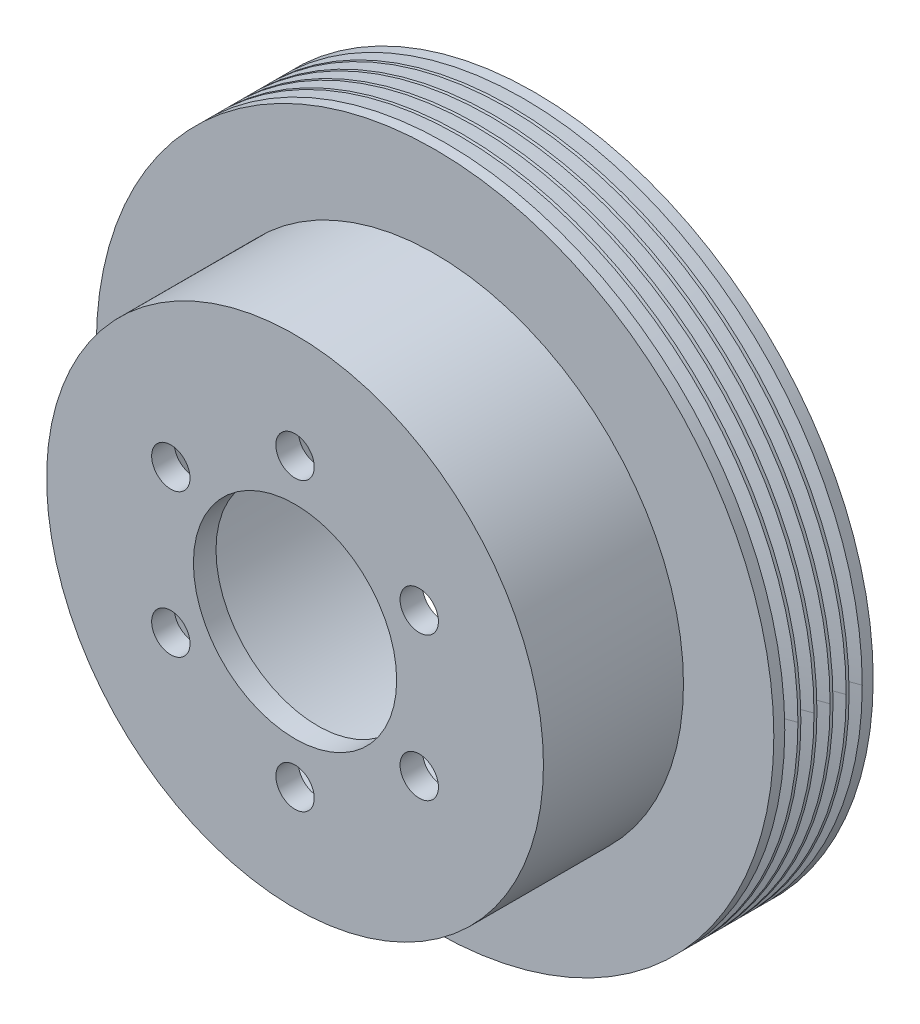
from build123d import *

# Parameters (mm, degrees)
ESQUISSE1_R                  = 75
BOSS_EXTRU_1_DEPTH           = 53
ENL_V_START                  = -31
ESQUISSE2_R                  = 75
ESQUISSE2_R_2                = 55
ENL_V_MAT_EXTRU_1_DEPTH      = 31
ESQUISSE3_R                  = 45
ENL_V_MAT_EXTRU_2_DEPTH      = 48
ESQUISSE4_R                  = 22.5
ENL_V_MAT_EXTRU_3_DEPTH      = 48
ESQUISSE5_R                  = 4.25
ENL_V_MAT_EXTRU_4_DEPTH      = 48
R_P_TITION_CIRCULAIRE1_COUNT = 6
R_P_TITION_LIN_AIRE1_COUNT   = 3
R_P_TITION_LIN_AIRE1_PITCH   = 3.56
R_P_TITION_LIN_AIRE2_COUNT   = 3
R_P_TITION_LIN_AIRE2_PITCH   = 3.56
CHANFREIN1_SIZE              = 0.567846251
CHANFREIN1_SIZE_2            = 0.8
CHANFREIN2_SIZE              = 5


with BuildPart() as part:
    # Esquisse1 → Boss.-Extru.1 (new body)
    with BuildSketch(Plane.XY):
        Circle(ESQUISSE1_R)
    extrude(amount=BOSS_EXTRU_1_DEPTH)

    # Esquisse2 → Enlèv. mat.-Extru.1 (cut)
    with BuildSketch(Plane.XY.offset(53).offset(ENL_V_START)):
        Circle(ESQUISSE2_R)
        Circle(ESQUISSE2_R_2, mode=Mode.SUBTRACT)
    extrude(amount=ENL_V_MAT_EXTRU_1_DEPTH, mode=Mode.SUBTRACT)

    # Esquisse3 → Enlèv. mat.-Extru.2 (cut)
    with BuildSketch(Plane(origin=(0, 0, 0), x_dir=(-1, 0, 0), z_dir=(0, 0, -1))):
        Circle(ESQUISSE3_R)
    extrude(amount=-ENL_V_MAT_EXTRU_2_DEPTH, mode=Mode.SUBTRACT)

    # Esquisse4 → Enlèv. mat.-Extru.3 (cut)
    with BuildSketch(Plane(origin=(0, 0, 48), x_dir=(-1, 0, 0), z_dir=(0, 0, -1))):
        Circle(ESQUISSE4_R)
    extrude(amount=-ENL_V_MAT_EXTRU_3_DEPTH, mode=Mode.SUBTRACT)

    # Esquisse5 → Enlèv. mat.-Extru.4 (cut)
    with BuildSketch(Plane.XY.offset(53)):
        with Locations((0, 31.75)):
            Circle(ESQUISSE5_R)
    enl_v_mat_extru_4 = extrude(amount=-ENL_V_MAT_EXTRU_4_DEPTH, mode=Mode.SUBTRACT)

    # Répétition circulaire1: Enlèv. mat.-Extru.4 ×6 about axis
    r_p_tition_circulaire1_axis = Axis((0, 0, 0), (0, 0, 1))
    for i in range(1, R_P_TITION_CIRCULAIRE1_COUNT):
        add(enl_v_mat_extru_4.rotate(r_p_tition_circulaire1_axis, i * 360 / R_P_TITION_CIRCULAIRE1_COUNT), mode=Mode.SUBTRACT)

    # Enlèvement de matière-Balayage1: sweep along a curve in space
    with BuildLine() as enl_vement_de_mati_re_balayage1_path:
        ThreePointArc((75, 0, 0), (53.033008589, 53.033008589, 0), (0, 75, 0))
        ThreePointArc((0, 75, 0), (-53.033008589, 53.033008589, 0), (-75, 0, 0))
        ThreePointArc((-75, 0, 0), (-53.033008589, -53.033008589, 0), (0, -75, 0))
        ThreePointArc((0, -75, 0), (53.033008589, -53.033008589, 0), (75, 0, 0))
    # Esquisse6 → Enlèvement de matière-Balayage1 (sweep, cut)
    with BuildSketch(Plane(origin=(0, 0, 0), x_dir=(1, 0, 0), z_dir=(0, 1, 0))):
        Polygon((-75.890509807, -12.78), (-71, -11), (-75.890509807, -9.22), align=None)
    enl_vement_de_mati_re_balayage1 = sweep(path=enl_vement_de_mati_re_balayage1_path.line, mode=Mode.SUBTRACT)

    # Répétition linéaire1: Enlèvement de matière-Balayage1 ×3
    with Locations(*[(0, 0, -i * R_P_TITION_LIN_AIRE1_PITCH) for i in range(1, R_P_TITION_LIN_AIRE1_COUNT)]):
        add(enl_vement_de_mati_re_balayage1, mode=Mode.SUBTRACT)

    # Répétition linéaire2: Enlèvement de matière-Balayage1 ×3
    with Locations(*[(0, 0, i * R_P_TITION_LIN_AIRE2_PITCH) for i in range(1, R_P_TITION_LIN_AIRE2_COUNT)]):
        add(enl_vement_de_mati_re_balayage1, mode=Mode.SUBTRACT)

    # Chanfrein1
    # the kernel refuses this chamfer: 0.8, 0.567846251 mm, written as the material it adds along each edge
    with BuildSketch(Plane(origin=(0, 0, 14.56), x_dir=(0, -1, 0), z_dir=(-1, 0, 0))) as chanfrein1_piece_1:
        Polygon((71 + CHANFREIN1_SIZE * 0.939692621403, -CHANFREIN1_SIZE * 0.34202014355), (71 + CHANFREIN1_SIZE_2 * 0.939692620786, CHANFREIN1_SIZE_2 * 0.342020143326), (71, 0), align=None)
    revolve(axis=Axis((0, 0, 14.56), (0, 0, 1)), revolution_arc=90)
    with BuildSketch(Plane(origin=(0, 0, 14.56), x_dir=(0, 1, 0), z_dir=(1, 0, 0))) as chanfrein1_piece_2:
        Polygon((71 + CHANFREIN1_SIZE * 0.939692621403, -CHANFREIN1_SIZE * 0.34202014355), (71 + CHANFREIN1_SIZE_2 * 0.939692620786, CHANFREIN1_SIZE_2 * 0.342020143326), (71, 0), align=None)
    revolve(axis=Axis((0, 0, 14.56), (0, 0, 1)), revolution_arc=90)
    with BuildSketch(Plane(origin=(0, 0, 18.12), x_dir=(-1, 0, 0), z_dir=(0, 1, 0))) as chanfrein1_piece_3:
        Polygon((71 + CHANFREIN1_SIZE_2 * 0.939692620786, CHANFREIN1_SIZE_2 * 0.342020143326), (71 + CHANFREIN1_SIZE * 0.939692621403, -CHANFREIN1_SIZE * 0.34202014355), (71, 0), align=None)
    revolve(axis=Axis((0, 0, 18.12), (0, 0, 1)), revolution_arc=90)
    with BuildSketch(Plane(origin=(0, 0, 18.12), x_dir=(0, 1, 0), z_dir=(1, 0, 0))) as chanfrein1_piece_4:
        Polygon((71 + CHANFREIN1_SIZE_2 * 0.939692620786, CHANFREIN1_SIZE_2 * 0.342020143326), (71 + CHANFREIN1_SIZE * 0.939692621403, -CHANFREIN1_SIZE * 0.34202014355), (71, 0), align=None)
    revolve(axis=Axis((0, 0, 18.12), (0, 0, 1)), revolution_arc=90)
    with BuildSketch(Plane(origin=(0, 0, 11), x_dir=(0, -1, 0), z_dir=(-1, 0, 0))) as chanfrein1_piece_5:
        Polygon((71 + CHANFREIN1_SIZE * 0.939692621403, -CHANFREIN1_SIZE * 0.34202014355), (71 + CHANFREIN1_SIZE_2 * 0.939692620786, CHANFREIN1_SIZE_2 * 0.342020143326), (71, 0), align=None)
    revolve(axis=Axis((0, 0, 11), (0, 0, 1)), revolution_arc=90)
    with BuildSketch(Plane(origin=(0, 0, 11), x_dir=(0, 1, 0), z_dir=(1, 0, 0))) as chanfrein1_piece_6:
        Polygon((71 + CHANFREIN1_SIZE * 0.939692621403, -CHANFREIN1_SIZE * 0.34202014355), (71 + CHANFREIN1_SIZE_2 * 0.939692620786, CHANFREIN1_SIZE_2 * 0.342020143326), (71, 0), align=None)
    revolve(axis=Axis((0, 0, 11), (0, 0, 1)), revolution_arc=90)
    with BuildSketch(Plane(origin=(0, 0, 7.44), x_dir=(0, -1, 0), z_dir=(-1, 0, 0))) as chanfrein1_piece_7:
        Polygon((71 + CHANFREIN1_SIZE * 0.939692621403, -CHANFREIN1_SIZE * 0.34202014355), (71 + CHANFREIN1_SIZE_2 * 0.939692620786, CHANFREIN1_SIZE_2 * 0.342020143326), (71, 0), align=None)
    revolve(axis=Axis((0, 0, 7.44), (0, 0, 1)), revolution_arc=90)
    with BuildSketch(Plane(origin=(0, 0, 7.44), x_dir=(0, 1, 0), z_dir=(1, 0, 0))) as chanfrein1_piece_8:
        Polygon((71 + CHANFREIN1_SIZE * 0.939692621403, -CHANFREIN1_SIZE * 0.34202014355), (71 + CHANFREIN1_SIZE_2 * 0.939692620786, CHANFREIN1_SIZE_2 * 0.342020143326), (71, 0), align=None)
    revolve(axis=Axis((0, 0, 7.44), (0, 0, 1)), revolution_arc=90)
    with BuildSketch(Plane(origin=(0, 0, 3.88), x_dir=(0, -1, 0), z_dir=(-1, 0, 0))) as chanfrein1_piece_9:
        Polygon((71 + CHANFREIN1_SIZE * 0.939692621403, -CHANFREIN1_SIZE * 0.34202014355), (71 + CHANFREIN1_SIZE_2 * 0.939692620786, CHANFREIN1_SIZE_2 * 0.342020143326), (71, 0), align=None)
    revolve(axis=Axis((0, 0, 3.88), (0, 0, 1)), revolution_arc=90)
    with BuildSketch(Plane(origin=(0, 0, 3.88), x_dir=(0, 1, 0), z_dir=(1, 0, 0))) as chanfrein1_piece_10:
        Polygon((71 + CHANFREIN1_SIZE * 0.939692621403, -CHANFREIN1_SIZE * 0.34202014355), (71 + CHANFREIN1_SIZE_2 * 0.939692620786, CHANFREIN1_SIZE_2 * 0.342020143326), (71, 0), align=None)
    revolve(axis=Axis((0, 0, 3.88), (0, 0, 1)), revolution_arc=90)
    with BuildSketch(Plane(origin=(0, 0, 3.88), x_dir=(1, 0, 0), z_dir=(0, -1, 0))) as chanfrein1_piece_11:
        Polygon((71 + CHANFREIN1_SIZE * 0.939692621403, -CHANFREIN1_SIZE * 0.34202014355), (71 + CHANFREIN1_SIZE_2 * 0.939692620786, CHANFREIN1_SIZE_2 * 0.342020143326), (71, 0), align=None)
    revolve(axis=Axis((0, 0, 3.88), (0, 0, 1)), revolution_arc=90)
    with BuildSketch(Plane(origin=(0, 0, 3.88), x_dir=(-1, 0, 0), z_dir=(0, 1, 0))) as chanfrein1_piece_12:
        Polygon((71 + CHANFREIN1_SIZE * 0.939692621403, -CHANFREIN1_SIZE * 0.34202014355), (71 + CHANFREIN1_SIZE_2 * 0.939692620786, CHANFREIN1_SIZE_2 * 0.342020143326), (71, 0), align=None)
    revolve(axis=Axis((0, 0, 3.88), (0, 0, 1)), revolution_arc=90)
    with BuildSketch(Plane(origin=(0, 0, 7.44), x_dir=(1, 0, 0), z_dir=(0, -1, 0))) as chanfrein1_piece_13:
        Polygon((71 + CHANFREIN1_SIZE * 0.939692621403, -CHANFREIN1_SIZE * 0.34202014355), (71 + CHANFREIN1_SIZE_2 * 0.939692620786, CHANFREIN1_SIZE_2 * 0.342020143326), (71, 0), align=None)
    revolve(axis=Axis((0, 0, 7.44), (0, 0, 1)), revolution_arc=90)
    with BuildSketch(Plane(origin=(0, 0, 7.44), x_dir=(-1, 0, 0), z_dir=(0, 1, 0))) as chanfrein1_piece_14:
        Polygon((71 + CHANFREIN1_SIZE * 0.939692621403, -CHANFREIN1_SIZE * 0.34202014355), (71 + CHANFREIN1_SIZE_2 * 0.939692620786, CHANFREIN1_SIZE_2 * 0.342020143326), (71, 0), align=None)
    revolve(axis=Axis((0, 0, 7.44), (0, 0, 1)), revolution_arc=90)
    with BuildSketch(Plane(origin=(0, 0, 11), x_dir=(1, 0, 0), z_dir=(0, -1, 0))) as chanfrein1_piece_15:
        Polygon((71 + CHANFREIN1_SIZE * 0.939692621403, -CHANFREIN1_SIZE * 0.34202014355), (71 + CHANFREIN1_SIZE_2 * 0.939692620786, CHANFREIN1_SIZE_2 * 0.342020143326), (71, 0), align=None)
    revolve(axis=Axis((0, 0, 11), (0, 0, 1)), revolution_arc=90)
    with BuildSketch(Plane(origin=(0, 0, 11), x_dir=(-1, 0, 0), z_dir=(0, 1, 0))) as chanfrein1_piece_16:
        Polygon((71 + CHANFREIN1_SIZE * 0.939692621403, -CHANFREIN1_SIZE * 0.34202014355), (71 + CHANFREIN1_SIZE_2 * 0.939692620786, CHANFREIN1_SIZE_2 * 0.342020143326), (71, 0), align=None)
    revolve(axis=Axis((0, 0, 11), (0, 0, 1)), revolution_arc=90)
    with BuildSketch(Plane(origin=(0, 0, 18.12), x_dir=(1, 0, 0), z_dir=(0, -1, 0))) as chanfrein1_piece_17:
        Polygon((71 + CHANFREIN1_SIZE_2 * 0.939692620786, CHANFREIN1_SIZE_2 * 0.342020143326), (71 + CHANFREIN1_SIZE * 0.939692621403, -CHANFREIN1_SIZE * 0.34202014355), (71, 0), align=None)
    revolve(axis=Axis((0, 0, 18.12), (0, 0, 1)), revolution_arc=90)
    with BuildSketch(Plane(origin=(0, 0, 18.12), x_dir=(0, -1, 0), z_dir=(-1, 0, 0))) as chanfrein1_piece_18:
        Polygon((71 + CHANFREIN1_SIZE_2 * 0.939692620786, CHANFREIN1_SIZE_2 * 0.342020143326), (71 + CHANFREIN1_SIZE * 0.939692621403, -CHANFREIN1_SIZE * 0.34202014355), (71, 0), align=None)
    revolve(axis=Axis((0, 0, 18.12), (0, 0, 1)), revolution_arc=90)
    with BuildSketch(Plane(origin=(0, 0, 14.56), x_dir=(1, 0, 0), z_dir=(0, -1, 0))) as chanfrein1_piece_19:
        Polygon((71 + CHANFREIN1_SIZE * 0.939692621403, -CHANFREIN1_SIZE * 0.34202014355), (71 + CHANFREIN1_SIZE_2 * 0.939692620786, CHANFREIN1_SIZE_2 * 0.342020143326), (71, 0), align=None)
    revolve(axis=Axis((0, 0, 14.56), (0, 0, 1)), revolution_arc=90)
    with BuildSketch(Plane(origin=(0, 0, 14.56), x_dir=(-1, 0, 0), z_dir=(0, 1, 0))) as chanfrein1_piece_20:
        Polygon((71 + CHANFREIN1_SIZE * 0.939692621403, -CHANFREIN1_SIZE * 0.34202014355), (71 + CHANFREIN1_SIZE_2 * 0.939692620786, CHANFREIN1_SIZE_2 * 0.342020143326), (71, 0), align=None)
    revolve(axis=Axis((0, 0, 14.56), (0, 0, 1)), revolution_arc=90)

    # Chanfrein2
    chanfrein2_edges = [part.edges().sort_by_distance(p)[0] for p in [
        (45, 0, 48),
    ]]
    chamfer(chanfrein2_edges, length=CHANFREIN2_SIZE)


solid = part.part
